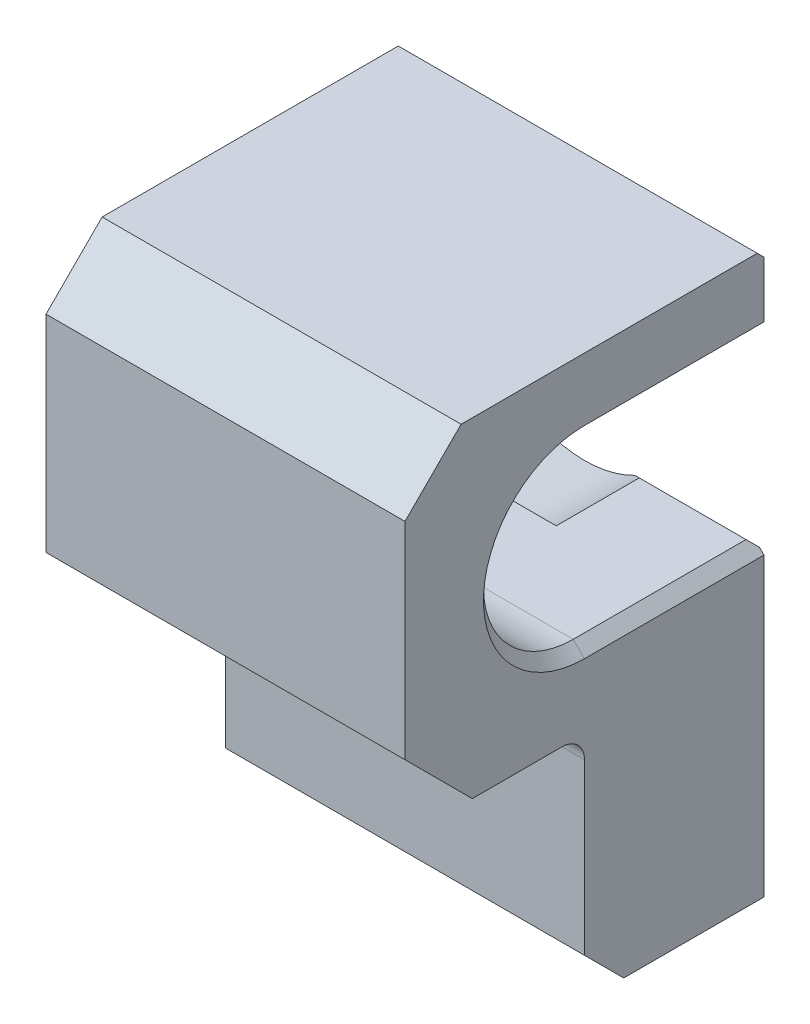
from build123d import *

# Parameters (mm, degrees)
BOSS_EXTRUDE1_DEPTH             = 8
BOSS_EXTRUDE1_DEPTH_BACK        = 8
SKETCH3_R                       = 4.85
CUT_EXTRUDE1_DEPTH              = 4
TAP_DRILL_FOR_1_4_20_TAP1_D     = 5.1054
TAP_DRILL_FOR_1_4_20_TAP1_DEPTH = 5.466183098
TAP_DRILL_FOR_1_4_20_TAP1_TIP   = 1.533816902
CHAMFER1_SIZE                   = 1
THREAD1_PITCH                   = 1.27
CHAMFER2_SIZE                   = 0.5


with BuildPart() as part:
    # Sketch2 → Boss-Extrude1 (new, two sides: drawn at the far end of the back side and taken through both)
    with BuildSketch(Plane(origin=(0, 0, 0), x_dir=(0, 0, -1), z_dir=(1, 0, 0)).offset(-BOSS_EXTRUDE1_DEPTH_BACK)):
        with BuildLine():
            Line((0, -0.3), (0, -13.7))
            Line((0, -13.7), (-6.25, -13.7))
            Line((-6.25, -13.7), (-8, -11.95))
            Line((-8, -11.95), (-8, -4.4))
            ThreePointArc((-8, -4.4), (-8.292893219, -3.692893219), (-9, -3.4))
            Line((-9, -3.4), (-13, -3.4))
            Line((-13, -3.4), (-16, -0.4))
            Line((-16, -0.4), (-16, 8.8))
            Line((-16, 8.8), (-13.5, 11.3))
            Line((-13.5, 11.3), (-0.3, 11.3))
            Line((-0.3, 11.3), (0, 11))
            Line((0, 11), (0, 8.3))
            Line((0, 8.3), (-0.3, 8))
            Line((-0.3, 8), (-8, 8))
            ThreePointArc((-8, 8), (-12, 4), (-8, 0))
            Line((-8, 0), (-0.3, 0))
            Line((-0.3, 0), (0, -0.3))
        make_face()
    extrude(amount=BOSS_EXTRUDE1_DEPTH + BOSS_EXTRUDE1_DEPTH_BACK)

    # Sketch3 → Cut-Extrude1 (cut)
    with BuildSketch(Plane(origin=(0, 0, 0), x_dir=(-1, 0, 0), z_dir=(0, 0, -1))):
        with Locations((0, 4)):
            Circle(SKETCH3_R)
    extrude(amount=-CUT_EXTRUDE1_DEPTH, mode=Mode.SUBTRACT)

    # Tap Drill for 1/4-20 Tap1
    with Locations(Plane(origin=(0, 0, 0), x_dir=(-1, 0, 0), z_dir=(0, 0, -1))):
        with Locations((0, -6.7)):
            Hole(TAP_DRILL_FOR_1_4_20_TAP1_D / 2, depth=TAP_DRILL_FOR_1_4_20_TAP1_DEPTH)
            with Locations((0, 0, -(TAP_DRILL_FOR_1_4_20_TAP1_DEPTH + TAP_DRILL_FOR_1_4_20_TAP1_TIP / 2))):  # 118° drill point
                Cone(0, TAP_DRILL_FOR_1_4_20_TAP1_D / 2, TAP_DRILL_FOR_1_4_20_TAP1_TIP, mode=Mode.SUBTRACT)

    # Chamfer1
    chamfer1_edges = [part.edges().sort_by_distance(p)[0] for p in [
        (-2.5527, -6.7, 0),
    ]]
    chamfer(chamfer1_edges, length=CHAMFER1_SIZE)

    # Thread1: the profile of Thread Profile1 profile screwed along a right-hand helix of 5.091483 turns, 8 arcs to a turn; built about Z, then put on its axis
    thread1_z = Axis((0, 0, 0), (0, 0, 1))
    thread1_corners = [(2.5524, 0, -0.000173205), (3.240107661, 0, 0.396874998), (3.240107661, 0, 0.555624998), (2.5524, 0, 0.952673202)]
    with BuildLine(mode=Mode.PRIVATE) as thread1_profile:
        Line(thread1_corners[0], thread1_corners[1])
        Line(thread1_corners[1], thread1_corners[2])
        Line(thread1_corners[2], thread1_corners[3])
        Line(thread1_corners[3], thread1_corners[0])
    thread1_cap = Face(thread1_profile.wire())
    thread1_turn_angles = [0, 22.5, 45, 67.5, 90, 112.5, 135, 157.5, 180, 202.5, 225, 247.5, 270, 292.5, 315, 337.5, 360]
    thread1_turn_weights = [1, 0.9238795325112867, 1, 0.9238795325112867, 1, 0.9238795325112867, 1, 0.9238795325112867, 1, 0.9238795325112867, 1, 0.9238795325112867, 1, 0.9238795325112867, 1, 0.9238795325112867, 1]
    thread1_turn_rails = [Edge.make_bspline([Vector(p[0], p[1], 0).rotate(thread1_z, thread1_turn_angles[k]) / thread1_turn_weights[k] + Vector(0, 0, p[2] + THREAD1_PITCH * thread1_turn_angles[k] / 360) for k in range(17)], [0, 0, 0, 1, 1, 2, 2, 3, 3, 4, 4, 5, 5, 6, 6, 7, 7, 8, 8, 8], 2, thread1_turn_weights) for p in thread1_corners]
    thread1_turn_sides = [Face.make_surface_from_curves(thread1_turn_rails[p[0]], thread1_turn_rails[p[1]]) for p in [(0, 1), (1, 2), (2, 3), (3, 0)]]
    thread1_last_angles = [1800, 1816.466895752, 1832.933791505]
    thread1_last_weights = [1, 0.9589836726700931, 1]
    thread1_last_rails = [Edge.make_bspline([Vector(p[0], p[1], 0).rotate(thread1_z, thread1_last_angles[k]) / thread1_last_weights[k] + Vector(0, 0, p[2] + THREAD1_PITCH * thread1_last_angles[k] / 360) for k in range(3)], [0, 0, 0, 1, 1, 1], 2, thread1_last_weights) for p in thread1_corners]
    thread1_last_sides = [Face.make_surface_from_curves(thread1_last_rails[p[0]], thread1_last_rails[p[1]]) for p in [(0, 1), (1, 2), (2, 3), (3, 0)]]
    thread1 = Plane(origin=(0, -6.7, -1), x_dir=(1, 0, 0), z_dir=(0, 0, 1)) * Solid(Shell([*[p.moved(Location((0, 0, THREAD1_PITCH * i))) for i in range(5) for p in thread1_turn_sides], *thread1_last_sides, thread1_cap, thread1_cap.rotate(thread1_z, 1832.933791505).moved(Location((0, 0, THREAD1_PITCH * 1832.933791505 / 360)))]))
    add(thread1, mode=Mode.SUBTRACT)

    # Chamfer2
    chamfer2_edges = [part.edges().sort_by_distance(p)[0] for p in [
        (-8, 0, 4.15),
        (-8, 8, 4.15),
        (-8, 4, 12),
        (8, 0, 4.15),
        (8, 8, 4.15),
        (8, 4, 12),
    ]]
    chamfer(chamfer2_edges, length=CHAMFER2_SIZE)


solid = part.part
